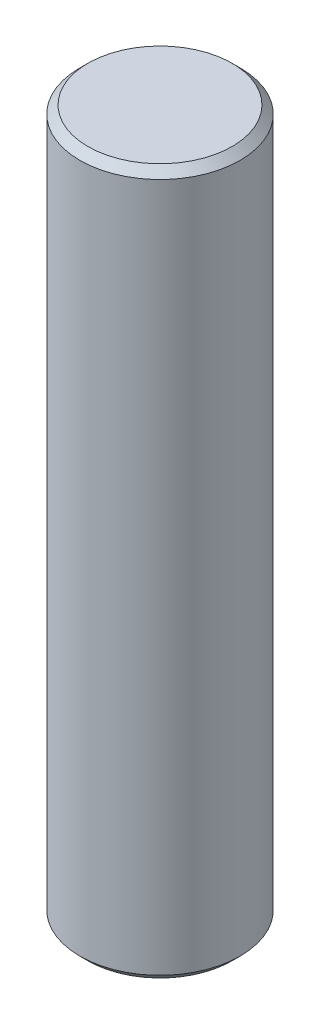
from build123d import *

# Parameters (mm, degrees)
SKETCH1_R           = 2.5
BOSS_EXTRUDE1_DEPTH = 22
CHAMFER1_SIZE       = 0.25


with BuildPart() as part:
    # Sketch1 → Boss-Extrude1 (new body)
    with BuildSketch(Plane(origin=(0, 0, 0), x_dir=(1, 0, 0), z_dir=(0, 1, 0))):
        Circle(SKETCH1_R)
    extrude(amount=BOSS_EXTRUDE1_DEPTH)

    # Chamfer1
    chamfer1_edges = [part.edges().sort_by_distance(p)[0] for p in [
        (-2.5, 0, 0),
        (-2.5, 22, 0),
    ]]
    chamfer(chamfer1_edges, length=CHAMFER1_SIZE)


solid = part.part
